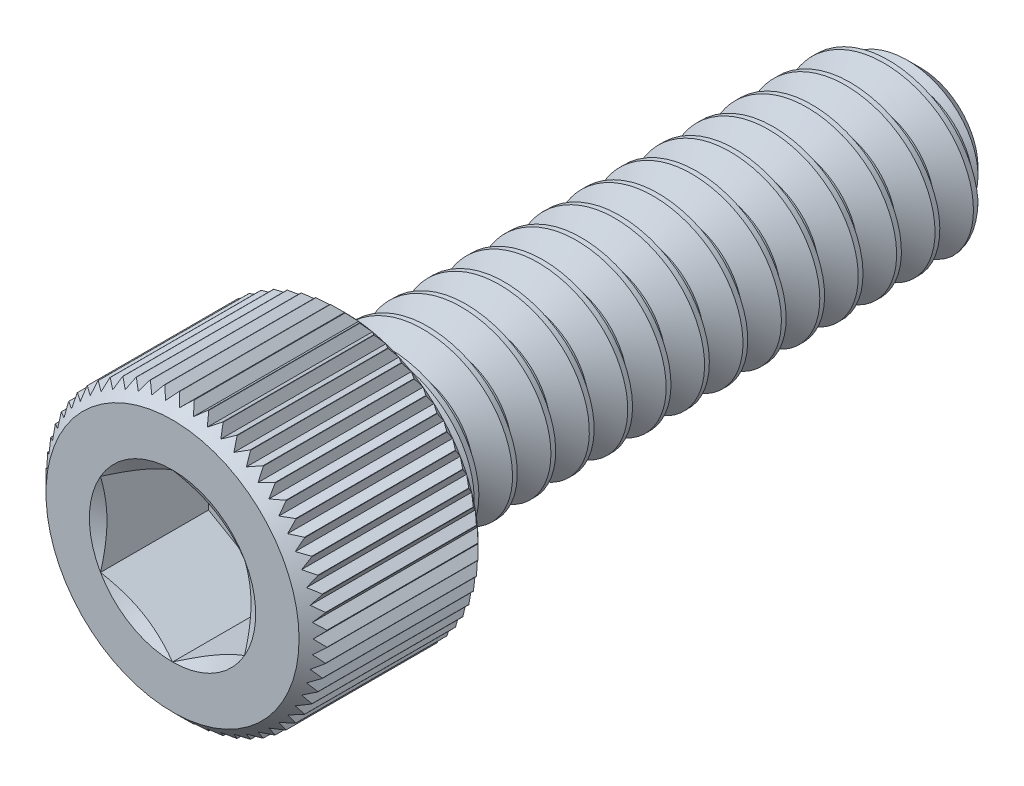
from build123d import *
from build123d.topology import SkipClean

# Parameters (mm, degrees)
CUT_EXTRUDE1_DEPTH = 1.7859375
CHAMFER1_SIZE      = 0.23241
CHAMFER2_SIZE      = 0.116205
CUT_SWEEP1_PITCH   = 0.635
CUT_SWEEP1_TO      = 9.525
CUT_EXTRUDE3_REACH = 12.076
CIRPATTERN1_COUNT  = 60


with BuildPart() as part:
    # Sketch2 → Revolve1 (revolve)
    with BuildSketch(Plane(origin=(0, 0, 0), x_dir=(0, 0, -1), z_dir=(1, 0, 0)), mode=Mode.PRIVATE) as revolve1_sk:
        Polygon((6.1849, 0.94615), (5.70865, 1.4224), (-3.3401, 1.4224), (-3.3401, 2.3241), (-6.1849, 2.3241), (-6.1849, 0), (6.1849, 0), align=None)
    revolve(revolve1_sk.sketch.rotate(Axis((0, 0, -6.1849), (0, 0, 1)), 90), axis=Axis((0, 0, -6.1849), (0, 0, 1)))

    # Sketch4 → Cut-Extrude1 (cut)
    with BuildSketch(Plane.XY.offset(6.1849)):
        Polygon((0, 1.374815329), (-1.190625, 0.687407664), (-1.190625, -0.687407664), (0, -1.374815329), (1.190625, -0.687407664), (1.190625, 0.687407664), align=None)
    extrude(amount=-CUT_EXTRUDE1_DEPTH, mode=Mode.SUBTRACT)

    # Cut-Extrude2 cone 1 section (through the dimple's axis) → Cut-Extrude2 (revolve, cut)
    with BuildSketch(Plane(origin=(0, 0, 6.1849), x_dir=(0, -1, 0), z_dir=(1, 0, 0))):
        Polygon((0, 0), (1.374815329, 0), (0, 0.79375), align=None)
    revolve(axis=Axis((0, 0, 6.1849), (0, 0, -1)), mode=Mode.SUBTRACT)

    # Chamfer1
    chamfer1_edges = [part.edges().sort_by_distance(p)[0] for p in [
        (2.3241, 0, 6.1849),
    ]]
    chamfer(chamfer1_edges, length=CHAMFER1_SIZE)

    # Chamfer2
    chamfer2_edges = [part.edges().sort_by_distance(p)[0] for p in [
        (2.3241, 0, 3.3401),
    ]]
    chamfer(chamfer2_edges, length=CHAMFER2_SIZE)


with BuildPart() as body_2:
    # Split1: read off the stored shape, not the designer's step
    # Split1: the piece on the far side of the plane
    add(part.part)
    split(bisect_by=Plane.XY.offset(3.3401), keep=Keep.BOTTOM)

    # Cut-Sweep1: arcs per turn and ends read off the stored shape
    # Cut-Sweep1: the profile of Sketch7 profile screwed along a right-hand helix through 16 turns, 6 arcs to a turn; built about Z, then put on its axis
    cut_sweep1_z = Axis((0, 0, 0), (0, 0, 1))
    cut_sweep1_corners = [(1.4227, 0, 0.000173205), (1.4227, 0, -0.555798205), (1.009955401, 0, -0.3175), (1.009955401, 0, -0.238125)]
    with BuildLine(mode=Mode.PRIVATE) as cut_sweep1_profile:
        Line(cut_sweep1_corners[0], cut_sweep1_corners[1])
        Line(cut_sweep1_corners[1], cut_sweep1_corners[2])
        Line(cut_sweep1_corners[2], cut_sweep1_corners[3])
        Line(cut_sweep1_corners[3], cut_sweep1_corners[0])
    cut_sweep1_cap = Face(cut_sweep1_profile.wire())
    cut_sweep1_turn_angles = [0, 30, 60, 90, 120, 150, 180, 210, 240, 270, 300, 330, 360]
    cut_sweep1_turn_weights = [1, 0.8660254037844387, 1, 0.8660254037844387, 1, 0.8660254037844387, 1, 0.8660254037844387, 1, 0.8660254037844387, 1, 0.8660254037844387, 1]
    cut_sweep1_turn_rails = [Edge.make_bspline([Vector(p[0], p[1], 0).rotate(cut_sweep1_z, cut_sweep1_turn_angles[k]) / cut_sweep1_turn_weights[k] + Vector(0, 0, p[2] + CUT_SWEEP1_PITCH * cut_sweep1_turn_angles[k] / 360) for k in range(13)], [0, 0, 0, 1, 1, 2, 2, 3, 3, 4, 4, 5, 5, 6, 6, 6], 2, cut_sweep1_turn_weights) for p in cut_sweep1_corners]
    cut_sweep1_turn_sides = [Face.make_surface_from_curves(cut_sweep1_turn_rails[p[0]], cut_sweep1_turn_rails[p[1]]) for p in [(0, 1), (1, 2), (2, 3), (3, 0)]]
    cut_sweep1 = Plane(origin=(0, 0, -6.1849), x_dir=(0, 1, 0), z_dir=(0, 0, 1)) * split(Solid(Shell([*[p.moved(Location((0, 0, CUT_SWEEP1_PITCH * i))) for i in range(16) for p in cut_sweep1_turn_sides], cut_sweep1_cap, cut_sweep1_cap.rotate(cut_sweep1_z, 5760).moved(Location((0, 0, CUT_SWEEP1_PITCH * 5760 / 360)))])), bisect_by=Plane.XY.offset(CUT_SWEEP1_TO), keep=Keep.BOTTOM, mode=Mode.PRIVATE)
    add(cut_sweep1, mode=Mode.SUBTRACT)


with BuildPart() as part_1:
    add(part.part)

    # Split1
    split(bisect_by=Plane.XY.offset(3.3401), keep=Keep.TOP)

    add(body_2.part)  # Boss-Extrude4 merges body 2
    # Boss-Extrude4: read off the stored shape, not the designer's step
    # Boss-Extrude4 outline → Boss-Extrude4 (revolve)
    with BuildSketch(Plane.XZ):
        Polygon((1.009908701, 3.3401), (1.009908701, 2.858867934), (1.491140766, 3.3401), align=None)
    revolve(axis=Axis((0, 0, 0), (0, 0, 1)))

    # Cut-Extrude3: up to this cone (the profile starts inside it)
    with SkipClean():  # the faces are left unmerged after this step: merging them gives an invalid solid
        cut_extrude3_end = Plane(origin=(0, 0, 3.3401), z_dir=(0, 0, -1)).offset(-4.936489) * Cone(1e-06, 22.44898, 22.448979, align=(Align.CENTER, Align.CENTER, Align.MIN), mode=Mode.PRIVATE)
        # Sketch9 → Cut-Extrude3 (cut, up to the surface)
        with BuildSketch(Plane(origin=(0, 0, 3.3401), x_dir=(-1, 0, 0), z_dir=(0, 0, -1)), mode=Mode.PRIVATE) as cut_extrude3_sk1:
            Polygon((0, 2.207895), (-0.24360184, 2.440305), (0.24360184, 2.440305), align=None)
        cut_extrude3_tool1 = extrude(cut_extrude3_sk1.sketch, amount=-CUT_EXTRUDE3_REACH, mode=Mode.PRIVATE) & cut_extrude3_end
        cut_extrude3 = cut_extrude3_tool1.solids().sort_by_distance((0, 2.362835, 3.3401))[0]
        add(cut_extrude3, mode=Mode.SUBTRACT)

    # CirPattern1: Cut-Extrude3 ×60 about axis
    cirpattern1_axis = Axis((0, 0, 0), (0, 0, 1))
    for i in range(1, CIRPATTERN1_COUNT):
        add(cut_extrude3.rotate(cirpattern1_axis, i * 360 / CIRPATTERN1_COUNT), mode=Mode.SUBTRACT)


solid = part_1.part
